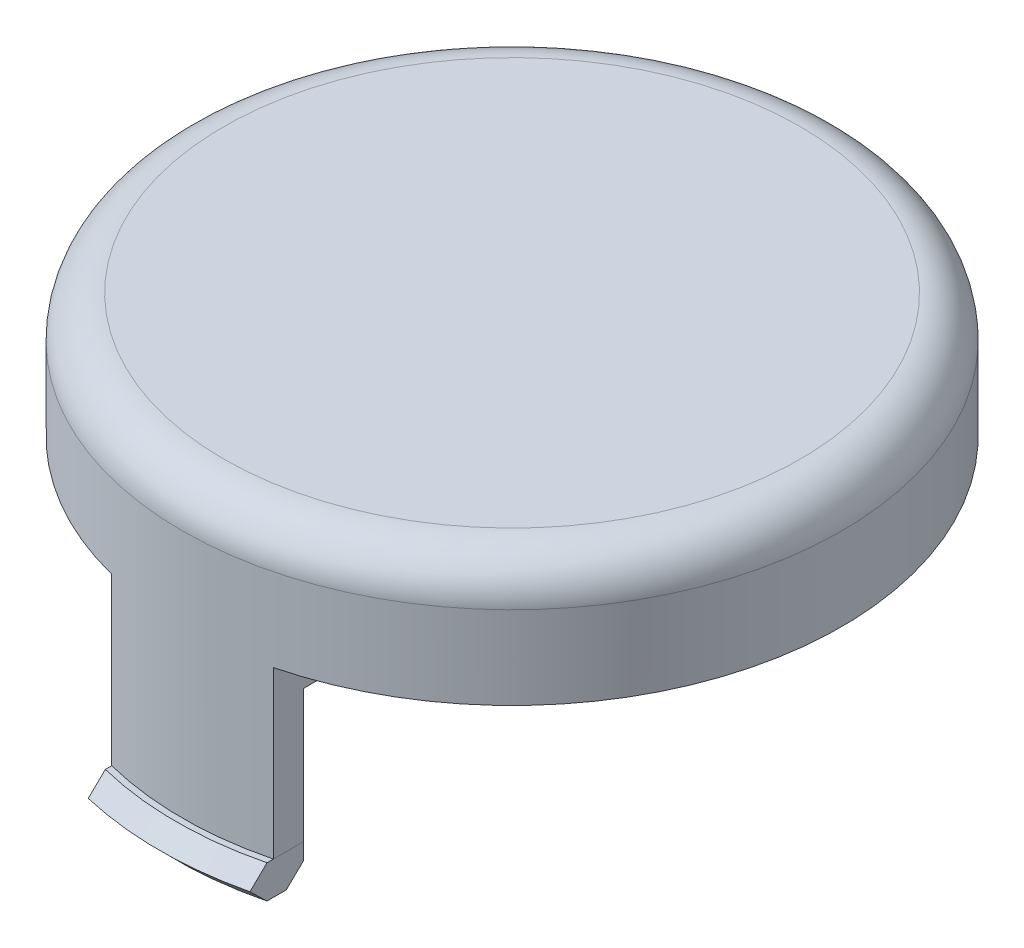
from build123d import *

# Parameters (mm, degrees)
SKETCH_2_R               = 7.95
EXTRUDE_1_DEPTH          = 5
SKETCH_4_R               = 8.5
EXTRUDE_2_DEPTH          = 0.8
SKETCH_3_R               = 7.25
CUT_EXTRUDE_2_DEPTH      = 4
CHAMFER_2_SIZE           = 0.4
CUT_EXTRUDE_3_DEPTH      = 14.019216566
CUT_EXTRUDE_3_DEPTH_BACK = 14.019216566
SKETCH_5_W               = 6
SKETCH_5_H               = 8
SKETCH_6_R               = 7.95
EXTRUDE_3_DEPTH          = 2
FILLET_1_R               = 1
SKETCH_7_R               = 6.5
CUT_EXTRUDE_4_DEPTH      = 1.5
CUT_EXTRUDE_8_DEPTH      = 14.910427743
CUT_EXTRUDE_8_DEPTH_BACK = 14.910427743
SKETCH_9_W               = 2.014745723
SKETCH_9_H               = 2.313226571
SKETCH_9_W_2             = 1.942835104
SKETCH_9_H_2             = 2.895732504


with BuildPart() as part:
    # 草图2 → 凸台-拉伸1 (new body)
    with BuildSketch(Plane(origin=(0, 0, 0), x_dir=(1, 0, 0), z_dir=(0, 1, 0))):
        with Locations(Location((0, 0, 0), (0, 0, 270))):
            Circle(SKETCH_2_R)
    extrude(amount=EXTRUDE_1_DEPTH)


with BuildPart() as body_2:
    # 草图4 → 凸台-拉伸2 (new body)
    with BuildSketch(Plane.XZ):
        with Locations(Location((0, 0, 0), (0, 0, 270))):
            Circle(SKETCH_4_R)
    extrude(amount=EXTRUDE_2_DEPTH)


with BuildPart() as cut_extrude_2_tool:
    # 草图3 → 切除-拉伸2 (new body)
    with BuildSketch(Plane.XZ.offset(0.8)):
        with Locations(Location((0, 0, 0), (0, 0, 270))):
            Circle(SKETCH_3_R)
    extrude(amount=-CUT_EXTRUDE_2_DEPTH)


with BuildPart() as part_1:
    add(part.part)

    # 切除-拉伸2: cut by cut_extrude_2_tool
    add(cut_extrude_2_tool.part, mode=Mode.SUBTRACT)


with BuildPart() as body_2_1:
    add(body_2.part)

    # 切除-拉伸2: cut by cut_extrude_2_tool
    add(cut_extrude_2_tool.part, mode=Mode.SUBTRACT)

    # 倒角2
    # the kernel refuses this chamfer: 0.4 mm, written as the material it takes off along each edge
    with BuildSketch(Plane(origin=(0, 0, 0), x_dir=(0, 0, -1), z_dir=(-1, 0, 0))) as chamfer_2_piece_1:
        Polygon((8.5, CHAMFER_2_SIZE), (8.5 - CHAMFER_2_SIZE, 0), (8.5, 0), align=None)
    revolve(axis=Axis((0, 0, 0), (0, -1, 0)), mode=Mode.SUBTRACT)
    with BuildSketch(Plane(origin=(0, -0.8, 0), x_dir=(0, 0, -1), z_dir=(-1, 0, 0))) as chamfer_2_piece_2:
        Polygon((8.5, -CHAMFER_2_SIZE), (8.5 - CHAMFER_2_SIZE, 0), (8.5, 0), align=None)
    revolve(axis=Axis((0, -0.8, 0), (0, -1, 0)), mode=Mode.SUBTRACT)
    with BuildSketch(Plane(origin=(0, -0.8, 0), x_dir=(0, 0, -1), z_dir=(-1, 0, 0))) as chamfer_2_piece_3:
        Polygon((7.25 + CHAMFER_2_SIZE, 0), (7.25, -CHAMFER_2_SIZE), (7.25, 0), align=None)
    revolve(axis=Axis((0, -0.8, 0), (0, -1, 0)), mode=Mode.SUBTRACT)


with BuildPart() as cut_extrude_3_tool:
    # 草图5 → 切除-拉伸3 (new, two sides: drawn at the far end of the back side and taken through both)
    with BuildSketch(Plane.XY.offset(-CUT_EXTRUDE_3_DEPTH_BACK)):
        with Locations((-4.95, 0)):
            Rectangle(SKETCH_5_W, SKETCH_5_H)
        with Locations((4.95, 0)):
            Rectangle(SKETCH_5_W, SKETCH_5_H)
    extrude(amount=CUT_EXTRUDE_3_DEPTH + CUT_EXTRUDE_3_DEPTH_BACK)


with BuildPart() as part_2:
    add(part_1.part)

    # 切除-拉伸3: cut by cut_extrude_3_tool
    add(cut_extrude_3_tool.part, mode=Mode.SUBTRACT)

    # 草图6 → 凸台-拉伸3 (add)
    with BuildSketch(Plane(origin=(0, 5, 0), x_dir=(1, 0, 0), z_dir=(0, 1, 0))):
        with Locations(Location((0, 0, 0), (0, 0, 75.801440125))):
            Circle(SKETCH_6_R)
    extrude(amount=EXTRUDE_3_DEPTH)

    # 圆角1
    fillet_1_edges = [part_2.edges().sort_by_distance(p)[0] for p in [
        (-1.95, 7, 7.707139547),
    ]]
    fillet(fillet_1_edges, radius=FILLET_1_R)

    # 草图7 → 切除-拉伸4 (cut)
    with BuildSketch(Plane.XZ.offset(-3.2)):
        with Locations(Location((0, 0, 0), (0, 0, 270))):
            Circle(SKETCH_7_R)
    extrude(amount=-CUT_EXTRUDE_4_DEPTH, mode=Mode.SUBTRACT)


with BuildPart() as body_2_2:
    add(body_2_1.part)

    # 切除-拉伸3: cut by cut_extrude_3_tool
    add(cut_extrude_3_tool.part, mode=Mode.SUBTRACT)

    # 草图9 → 切除-拉伸8 (cut, two sides: drawn at the far end of the back side and taken through both)
    with BuildSketch(Plane.XY.offset(-CUT_EXTRUDE_8_DEPTH_BACK)):
        with Locations((-8.140610587, -0.399654316)):
            Rectangle(SKETCH_9_W, SKETCH_9_H)
        with Locations((7.842413689, -0.690907284)):
            Rectangle(SKETCH_9_W_2, SKETCH_9_H_2)
    extrude(amount=CUT_EXTRUDE_8_DEPTH + CUT_EXTRUDE_8_DEPTH_BACK, mode=Mode.SUBTRACT)


solid = Compound([part_2.part, body_2_2.part])
